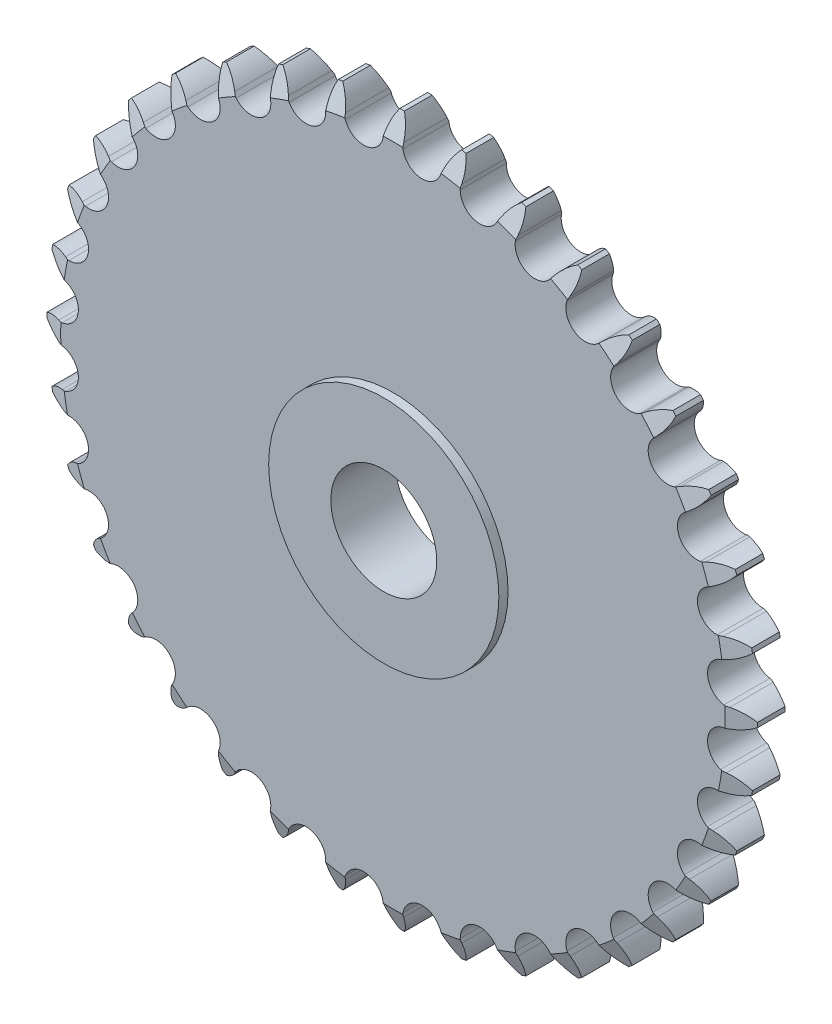
from build123d import *

# Parameters (mm, degrees)
SKETCH2_R                       = 68.60307911
BOSS_EXTRUDE1_DEPTH             = 5
BOSS_EXTRUDE2_REACH             = 99.148
BOSS_EXTRUDE2_DIRECTION_2_REACH = 99.148
CIRPATTERN1_COUNT               = 36
SKETCH6_R                       = 25
BOSS_EXTRUDE3_DEPTH             = 7
CUT_EXTRUDE1_DEPTH              = 110.349255378
CUT_EXTRUDE1_DEPTH_BACK         = 110.349255378
SKETCH7_R                       = 11.5


with BuildPart() as part:
    # Sketch2 → Boss-Extrude1 (new, symmetric)
    with BuildSketch(Plane.XY):
        Circle(SKETCH2_R)
    extrude(amount=BOSS_EXTRUDE1_DEPTH, both=True)

    # Boss-Extrude2: up to this face of the body (flat: up to its plane)
    boss_extrude2_end = Plane(part.part.faces().sort_by_distance((0, 0, 5))[0])
    # Sketch4 → Boss-Extrude2 (add, up to the picked face)
    with BuildSketch(Plane.XY, mode=Mode.PRIVATE) as boss_extrude2_sk1:
        with BuildLine():
            Line((-0.5, 77.163008044), (0.5, 77.163008044))
            ThreePointArc((0.5, 77.163008044), (1.520836, 75.099924668), (2.042896963, 72.85807911))
            Line((2.042896963, 72.85807911), (2.156832572, 71.85807911))
            ThreePointArc((2.156832572, 71.85807911), (3.469336894, 69.449250243), (5.979152315, 68.342023682))
            ThreePointArc((5.979152315, 68.342023682), (0, 68.60307911), (-5.979152315, 68.342023682))
            ThreePointArc((-5.979152315, 68.342023682), (-3.469336894, 69.449250243), (-2.156832572, 71.85807911))
            Line((-2.156832572, 71.85807911), (-2.042896963, 72.85807911))
            ThreePointArc((-2.042896963, 72.85807911), (-1.520836, 75.099924668), (-0.5, 77.163008044))
        make_face()
    boss_extrude2_tool1 = split(extrude(boss_extrude2_sk1.sketch, amount=BOSS_EXTRUDE2_REACH, mode=Mode.PRIVATE), bisect_by=boss_extrude2_end, keep=Keep.BOTH, mode=Mode.PRIVATE)
    boss_extrude2 = boss_extrude2_tool1.solids().sort_by(Axis((0, 71.819777, 0), (0, 0, 1)))[0]
    add(boss_extrude2)

    # Boss-Extrude2 direction 2: up to this face of the body (flat: up to its plane)
    boss_extrude2_direction_2_end = Plane(part.part.faces().sort_by_distance((0, 0, -5))[0])
    # Sketch4 → Boss-Extrude2 direction 2 (add, up to the picked face)
    with BuildSketch(Plane.XY, mode=Mode.PRIVATE) as boss_extrude2_direction_2_sk1:
        with BuildLine():
            Line((-0.5, 77.163008044), (0.5, 77.163008044))
            ThreePointArc((0.5, 77.163008044), (1.520836, 75.099924668), (2.042896963, 72.85807911))
            Line((2.042896963, 72.85807911), (2.156832572, 71.85807911))
            ThreePointArc((2.156832572, 71.85807911), (3.469336894, 69.449250243), (5.979152315, 68.342023682))
            ThreePointArc((5.979152315, 68.342023682), (0, 68.60307911), (-5.979152315, 68.342023682))
            ThreePointArc((-5.979152315, 68.342023682), (-3.469336894, 69.449250243), (-2.156832572, 71.85807911))
            Line((-2.156832572, 71.85807911), (-2.042896963, 72.85807911))
            ThreePointArc((-2.042896963, 72.85807911), (-1.520836, 75.099924668), (-0.5, 77.163008044))
        make_face()
    boss_extrude2_direction_2_tool1 = split(extrude(boss_extrude2_direction_2_sk1.sketch, amount=-BOSS_EXTRUDE2_DIRECTION_2_REACH, mode=Mode.PRIVATE), bisect_by=boss_extrude2_direction_2_end, keep=Keep.BOTH, mode=Mode.PRIVATE)
    boss_extrude2_direction_2 = boss_extrude2_direction_2_tool1.solids().sort_by(Axis((0, 71.819777, 0), (0, 0, -1)))[0]
    add(boss_extrude2_direction_2)

    # CirPattern1: Boss-Extrude2, Boss-Extrude2 direction 2 ×36 about axis
    cirpattern1_axis = Axis((0, 0, 5), (0, 0, -1))
    add([boss_extrude2.rotate(cirpattern1_axis, i * 360 / CIRPATTERN1_COUNT) for i in range(1, CIRPATTERN1_COUNT)])
    add([boss_extrude2_direction_2.rotate(cirpattern1_axis, i * 360 / CIRPATTERN1_COUNT) for i in range(1, CIRPATTERN1_COUNT)])

    # Sketch5 → Cut-Revolve7 (revolve, cut)
    with BuildSketch(Plane(origin=(0, 0, 0), x_dir=(0, 0, -1), z_dir=(1, 0, 0))):
        Polygon((6, 84.663008044), (0, 84.663008044), (6, 69.663008044), align=None)
        Polygon((0, 84.663008044), (-6, 84.663008044), (-6, 69.663008044), align=None)
    revolve(axis=Axis((0, 0, 0), (0, 0, 1)), mode=Mode.SUBTRACT)

    # Sketch6 → Boss-Extrude3 (add, symmetric)
    with BuildSketch(Plane.XY):
        Circle(SKETCH6_R)
    extrude(amount=BOSS_EXTRUDE3_DEPTH, both=True)

    # Sketch7 → Cut-Extrude1 (cut, two sides: drawn at the far end of the back side and taken through both)
    with BuildSketch(Plane.XY.offset(-CUT_EXTRUDE1_DEPTH_BACK)):
        Circle(SKETCH7_R)
    extrude(amount=CUT_EXTRUDE1_DEPTH + CUT_EXTRUDE1_DEPTH_BACK, mode=Mode.SUBTRACT)


solid = part.part
